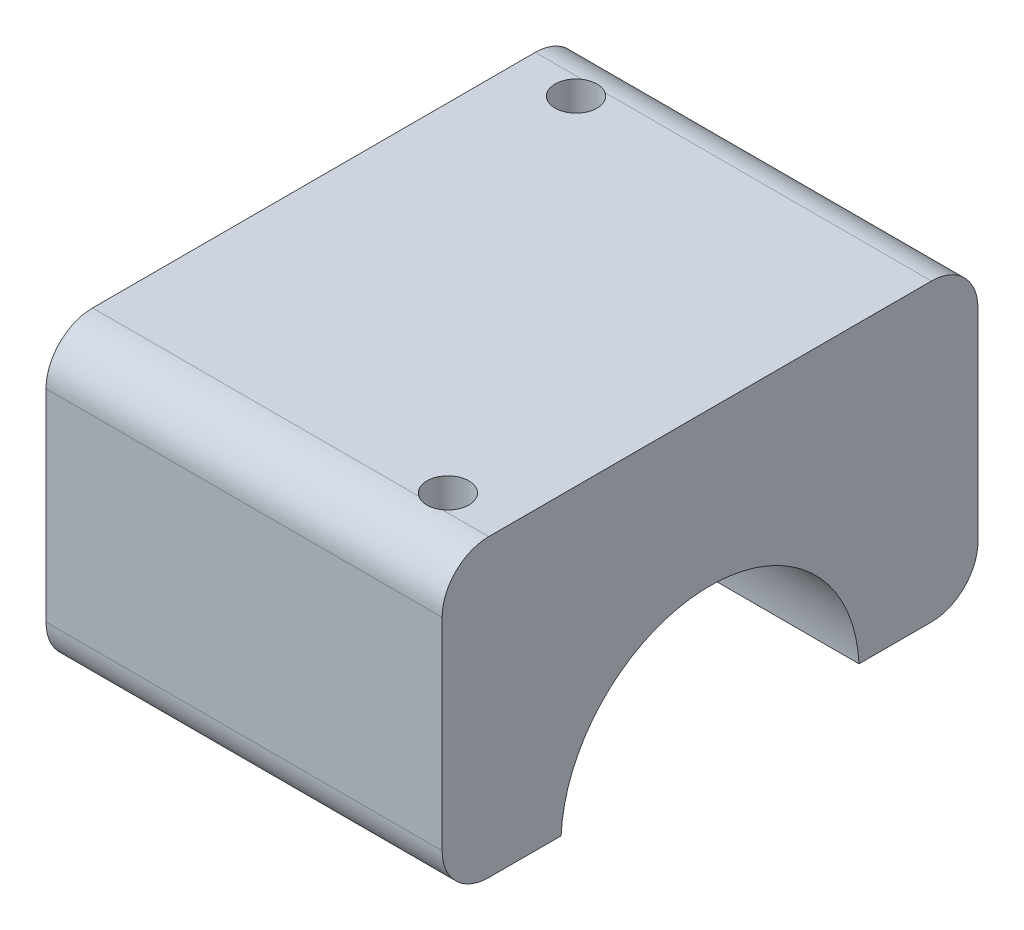
from build123d import *

# Parameters (mm, degrees)
BOSS_EXTRUDE1_DEPTH     = 17
CUT_EXTRUDE1_DEPTH      = 39.619352675
CUT_EXTRUDE1_DEPTH_BACK = 39.619352675
SKETCH2_R               = 12.8
SKETCH3_R               = 1.8
CUT_EXTRUDE2_DEPTH      = 25.951


with BuildPart() as part:
    # Sketch1 → Boss-Extrude1 (new, symmetric)
    with BuildSketch(Plane(origin=(0, 0, 0), x_dir=(0, 0, -1), z_dir=(1, 0, 0))):
        with BuildLine():
            Line((-19, 0.6), (19, 0.6))
            ThreePointArc((19, 0.6), (21.828427125, 1.771572875), (23, 4.6))
            Line((23, 4.6), (23, 21.951))
            ThreePointArc((23, 21.951), (21.828427125, 24.779427125), (19, 25.951))
            Line((19, 25.951), (-19, 25.951))
            ThreePointArc((-19, 25.951), (-21.828427125, 24.779427125), (-23, 21.951))
            Line((-23, 21.951), (-23, 4.6))
            ThreePointArc((-23, 4.6), (-21.828427125, 1.771572875), (-19, 0.6))
        make_face()
    extrude(amount=BOSS_EXTRUDE1_DEPTH, both=True)

    # Sketch2 → Cut-Extrude1 (cut, two sides: drawn at the far end of the back side and taken through both)
    with BuildSketch(Plane(origin=(0, 0, 0), x_dir=(0, 0, -1), z_dir=(1, 0, 0)).offset(-CUT_EXTRUDE1_DEPTH_BACK)):
        Circle(SKETCH2_R)
    extrude(amount=CUT_EXTRUDE1_DEPTH + CUT_EXTRUDE1_DEPTH_BACK, mode=Mode.SUBTRACT)

    # Sketch3 → Cut-Extrude2 (cut)
    with BuildSketch(Plane(origin=(0, 0.6, 0), x_dir=(1, 0, 0), z_dir=(0, 1, 0))):
        with Locations((12, -17.5)):
            Circle(SKETCH3_R)
        with Locations((-12, 17.5)):
            Circle(SKETCH3_R)
    extrude(amount=CUT_EXTRUDE2_DEPTH, mode=Mode.SUBTRACT)


solid = part.part
